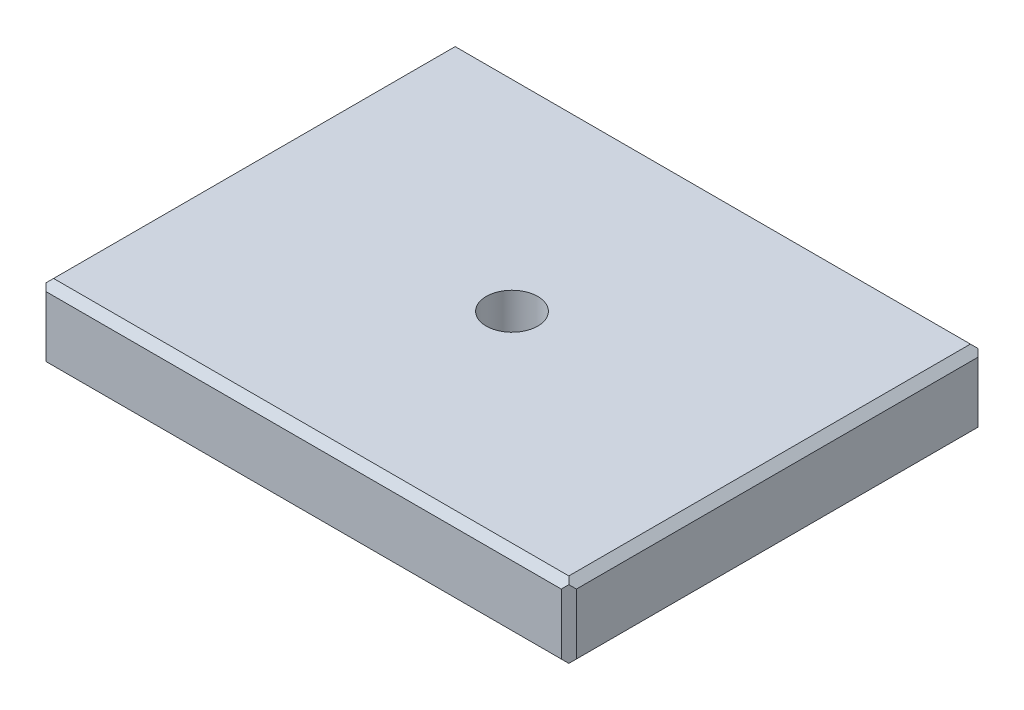
from build123d import *

# Parameters (mm, degrees)
SKETCH1_W           = 70
SKETCH1_H           = 55
BOSS_EXTRUDE1_DEPTH = 10
CHAMFER1_SIZE       = 1
M8_TAPPED_HOLE1_D   = 6.8
CHAMFER3_SIZE       = 1


with BuildPart() as part:
    # Sketch1 → Boss-Extrude1 (new body)
    with BuildSketch(Plane(origin=(0, 0, 0), x_dir=(1, 0, 0), z_dir=(0, 1, 0))):
        Rectangle(SKETCH1_W, SKETCH1_H)
    extrude(amount=-BOSS_EXTRUDE1_DEPTH)

    # Chamfer1
    chamfer1_edges = [part.edges().sort_by_distance(p)[0] for p in [
        (0, -10, -27.5),
        (-35, -10, 0),
        (0, -10, 27.5),
        (35, -10, 0),
        (0, 0, 27.5),
        (-35, 0, 0),
        (0, 0, -27.5),
        (35, 0, 0),
    ]]
    chamfer(chamfer1_edges, length=CHAMFER1_SIZE)

    # M8 Tapped Hole1 (through all)
    with Locations(Plane(origin=(0, 0, 0), x_dir=(1, 0, 0), z_dir=(0, 1, 0))):
        with Locations((0, 0)):
            Hole(M8_TAPPED_HOLE1_D / 2)

    # Chamfer3
    chamfer3_edges = [part.edges().sort_by_distance(p)[0] for p in [
        (-35, -5, -27.5),
        (35, -5, -27.5),
        (35, -5, 27.5),
        (-35, -5, 27.5),
    ]]
    chamfer(chamfer3_edges, length=CHAMFER3_SIZE)


solid = part.part
